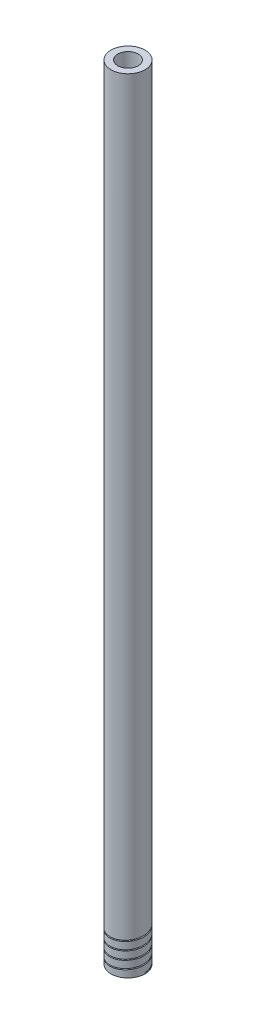
from build123d import *

# Parameters (mm, degrees)
SKETCH1_R           = 25
BOSS_EXTRUDE1_DEPTH = 100
SKETCH2_R           = 25
BOSS_EXTRUDE2_DEPTH = 1050
THREAD1_PITCH       = 12
SKETCH5_R           = 15
CUT_EXTRUDE1_DEPTH  = 75


with BuildPart() as part:
    # Sketch1 → Boss-Extrude1 (new body)
    with BuildSketch(Plane(origin=(0, 0, 0), x_dir=(1, 0, 0), z_dir=(0, 1, 0))):
        with Locations(Location((0, 0, 0), (0, 0, 270))):
            Circle(SKETCH1_R)
    extrude(amount=BOSS_EXTRUDE1_DEPTH)

    # Sketch2 → Boss-Extrude2 (add)
    with BuildSketch(Plane(origin=(0, 100, 0), x_dir=(1, 0, 0), z_dir=(0, 1, 0))):
        with Locations(Location((0, 0, 0), (0, 0, 270))):
            Circle(SKETCH2_R)
    extrude(amount=BOSS_EXTRUDE2_DEPTH)

    # Thread1: the profile of Thread Profile1 profile screwed along a right-hand helix of 4.166667 turns, 16 arcs to a turn; built about Z, then put on its axis
    thread1_z = Axis((0, 0, 0), (0, 0, 1))
    thread1_corners = [(25.0003, 0, -0.000173205), (25.0003, 0, 1.7501732), (23.91746825, 0, 1.124999997), (23.91746825, 0, 0.624999997)]
    with BuildLine(mode=Mode.PRIVATE) as thread1_profile:
        Line(thread1_corners[0], thread1_corners[1])
        Line(thread1_corners[1], thread1_corners[2])
        Line(thread1_corners[2], thread1_corners[3])
        Line(thread1_corners[3], thread1_corners[0])
    thread1_cap = Face(thread1_profile.wire())
    thread1_turn_angles = [0, 11.25, 22.5, 33.75, 45, 56.25, 67.5, 78.75, 90, 101.25, 112.5, 123.75, 135, 146.25, 157.5, 168.75, 180, 191.25, 202.5, 213.75, 225, 236.25, 247.5, 258.75, 270, 281.25, 292.5, 303.75, 315, 326.25, 337.5, 348.75, 360]
    thread1_turn_weights = [1, 0.9807852804032304, 1, 0.9807852804032304, 1, 0.9807852804032304, 1, 0.9807852804032304, 1, 0.9807852804032304, 1, 0.9807852804032304, 1, 0.9807852804032304, 1, 0.9807852804032304, 1, 0.9807852804032304, 1, 0.9807852804032304, 1, 0.9807852804032304, 1, 0.9807852804032304, 1, 0.9807852804032304, 1, 0.9807852804032304, 1, 0.9807852804032304, 1, 0.9807852804032304, 1]
    thread1_turn_rails = [Edge.make_bspline([Vector(p[0], p[1], 0).rotate(thread1_z, thread1_turn_angles[k]) / thread1_turn_weights[k] + Vector(0, 0, p[2] + THREAD1_PITCH * thread1_turn_angles[k] / 360) for k in range(33)], [0, 0, 0, 1, 1, 2, 2, 3, 3, 4, 4, 5, 5, 6, 6, 7, 7, 8, 8, 9, 9, 10, 10, 11, 11, 12, 12, 13, 13, 14, 14, 15, 15, 16, 16, 16], 2, thread1_turn_weights) for p in thread1_corners]
    thread1_turn_sides = [Face.make_surface_from_curves(thread1_turn_rails[p[0]], thread1_turn_rails[p[1]]) for p in [(0, 1), (1, 2), (2, 3), (3, 0)]]
    thread1_last_angles = [1440, 1451.25, 1462.5, 1473.75, 1485, 1492.5, 1500]
    thread1_last_weights = [1, 0.9807852804032304, 1, 0.9807852804032304, 1, 0.9914448613738104, 1]
    thread1_last_rails = [Edge.make_bspline([Vector(p[0], p[1], 0).rotate(thread1_z, thread1_last_angles[k]) / thread1_last_weights[k] + Vector(0, 0, p[2] + THREAD1_PITCH * thread1_last_angles[k] / 360) for k in range(7)], [0, 0, 0, 1, 1, 2, 2, 3, 3, 3], 2, thread1_last_weights) for p in thread1_corners]
    thread1_last_sides = [Face.make_surface_from_curves(thread1_last_rails[p[0]], thread1_last_rails[p[1]]) for p in [(0, 1), (1, 2), (2, 3), (3, 0)]]
    thread1 = Plane(origin=(0, 0, 0), x_dir=(1, 0, 0), z_dir=(0, 1, 0)) * Solid(Shell([*[p.moved(Location((0, 0, THREAD1_PITCH * i))) for i in range(4) for p in thread1_turn_sides], *thread1_last_sides, thread1_cap, thread1_cap.rotate(thread1_z, 1500).moved(Location((0, 0, THREAD1_PITCH * 1500 / 360)))]))
    add(thread1, mode=Mode.SUBTRACT)

    # Sketch5 → Cut-Extrude1 (cut)
    with BuildSketch(Plane(origin=(0, 1150, 0), x_dir=(1, 0, 0), z_dir=(0, 1, 0))):
        with Locations(Location((0, 0, 0), (0, 0, 270))):
            Circle(SKETCH5_R)
    extrude(amount=-CUT_EXTRUDE1_DEPTH, mode=Mode.SUBTRACT)


solid = part.part
